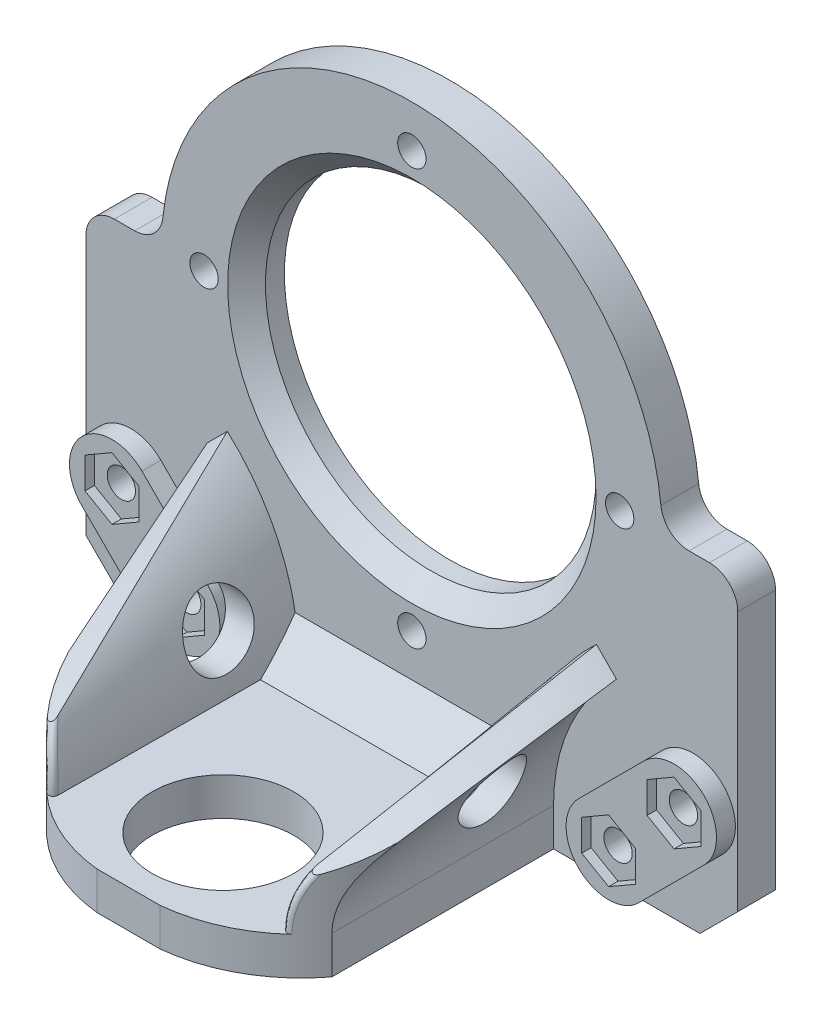
from build123d import *

# Parameters (mm, degrees)
SKETCH_1_R               = 34.5
EXTRUDE_1_DEPTH          = 4
SKETCH_2_R               = 1.5
CUT_EXTRUDE_1_DEPTH      = 4
SKETCH_3_R               = 1.5
CUT_EXTRUDE_2_DEPTH      = 4
CUT_EXTRUDE_START        = -4
CUT_EXTRUDE_3_DEPTH      = 4
FILLET_1_R               = 3
SKETCH_5_R               = 17.5
CUT_EXTRUDE_4_DEPTH      = 4
EXTRUDE_START            = 2
SKETCH_6_R               = 4.5
SKETCH_6_R_2             = 1.5
EXTRUDE_2_DEPTH          = 2
CUT_EXTRUDE_5_DEPTH      = 1
CHAMFER_1_SIZE           = 4
SKETCH_8_W               = 30
SKETCH_8_H               = 4
EXTRUDE_3_DEPTH          = 30
CUT_EXTRUDE_7_DEPTH      = 30
FILLET_3_R               = 0.5
SKETCH_13_R              = 7.5
CUT_EXTRUDE_8_DEPTH      = 30
CHAMFER_2_SIZE           = 4
CUT_EXTRUDE_9_DEPTH      = 60.468479219
CUT_EXTRUDE_9_DEPTH_BACK = 60.468479219
SKETCH_14_R              = 3.5
CHAMFER_3_SIZE           = 2


with BuildPart() as part:
    # Эскиз1 → Бобышка-Вытянуть1 (new body)
    with BuildSketch(Plane.XY):
        with BuildLine():
            Line((-34.5, 0), (-34.5, -34.5))
            Line((-34.5, -34.5), (-2e-09, -34.5))
            ThreePointArc((-2e-09, -34.5), (-24.395183952, -24.39518395), (-34.5, 0))
        make_face()
        with BuildLine():
            ThreePointArc((34.5, 0), (24.39518395, -24.395183952), (-2e-09, -34.5))
            Line((-2e-09, -34.5), (34.5, -34.5))
            Line((34.5, -34.5), (34.5, 0))
        make_face()
        Circle(SKETCH_1_R)
    extrude(amount=EXTRUDE_1_DEPTH)

    # Эскиз2 → Вырез-Вытянуть1 (cut)
    with BuildSketch(Plane.XY.offset(4)):
        with Locations((-29.750750261, -22.828553588)):
            Circle(SKETCH_2_R)
        with Locations(Location((-22.828553588, -29.750750261, 0), (0, 0, 180))):
            Circle(SKETCH_2_R)
        with Locations(Location((29.750750261, -22.828553588, 0), (0, 0, 180))):
            Circle(SKETCH_2_R)
        with Locations((22.828553588, -29.750750261)):
            Circle(SKETCH_2_R)
    extrude(amount=-CUT_EXTRUDE_1_DEPTH, mode=Mode.SUBTRACT)

    # Эскиз3 → Вырез-Вытянуть2 (cut)
    with BuildSketch(Plane.XY.offset(4)):
        with Locations((0, 22)):
            Circle(SKETCH_3_R)
        with Locations((22, 0)):
            Circle(SKETCH_3_R)
        with Locations((0, -22)):
            Circle(SKETCH_3_R)
        with Locations((-22, 0)):
            Circle(SKETCH_3_R)
    extrude(amount=-CUT_EXTRUDE_2_DEPTH, mode=Mode.SUBTRACT)

    # Эскиз4 → Вырез-Вытянуть3 (cut)
    with BuildSketch(Plane.XY.offset(4).offset(CUT_EXTRUDE_START)):
        with BuildLine():
            Line((-34.5, 0), (-26.5, 0))
            ThreePointArc((-26.5, 0), (0, 26.5), (26.5, 0))
            Line((26.5, 0), (34.5, 0))
            ThreePointArc((34.5, 0), (0, 34.5), (-34.5, 0))
        make_face()
    extrude(amount=CUT_EXTRUDE_3_DEPTH, mode=Mode.SUBTRACT)

    # Скругление1
    fillet_1_edges = [part.edges().sort_by_distance(p)[0] for p in [
        (26.5, 0, 2),
        (-26.5, 0, 2),
        (-34.5, 0, 2),
        (34.5, 0, 2),
    ]]
    fillet(fillet_1_edges, radius=FILLET_1_R)

    # Эскиз5 → Вырез-Вытянуть4 (cut)
    with BuildSketch(Plane.XY.offset(4)):
        Circle(SKETCH_5_R)
    extrude(amount=-CUT_EXTRUDE_4_DEPTH, mode=Mode.SUBTRACT)

    # Эскиз6 → Бобышка-Вытянуть2 (add)
    # profile 1 of 6: a face of its own
    with BuildSketch(Plane.XY.offset(4).offset(EXTRUDE_START)):
        with BuildLine():
            ThreePointArc((-25.250750261, -22.828553588), (-28.028674815, -26.986011484), (-32.932730776, -26.010534103))
            Line((-32.932730776, -26.010534103), (-26.010534103, -32.932730776))
            ThreePointArc((-26.010534103, -32.932730776), (-26.010534103, -26.568769746), (-19.646573072, -26.568769746))
            Line((-19.646573072, -26.568769746), (-26.568769746, -19.646573072))
            ThreePointArc((-26.568769746, -19.646573072), (-25.593292365, -21.106478142), (-25.250750261, -22.828553588))
        make_face()
    # profile 2 of 6: a face of its own
    with BuildSketch(Plane.XY.offset(4).offset(EXTRUDE_START)):
        with Locations((-29.750750261, -22.828553588)):
            Circle(SKETCH_6_R)
        with Locations((-29.750750261, -22.828553588)):
            Circle(SKETCH_6_R_2, mode=Mode.SUBTRACT)
    # profile 3 of 6: a face of its own
    with BuildSketch(Plane.XY.offset(4).offset(EXTRUDE_START)):
        with Locations((-22.828553588, -29.750750261)):
            Circle(SKETCH_6_R)
        with Locations((-22.828553588, -29.750750261)):
            Circle(SKETCH_6_R_2, mode=Mode.SUBTRACT)
    # profile 4 of 6: a face of its own
    with BuildSketch(Plane.XY.offset(4).offset(EXTRUDE_START)):
        with Locations((22.828553588, -29.750750261)):
            Circle(SKETCH_6_R)
        with Locations((22.828553588, -29.750750261)):
            Circle(SKETCH_6_R_2, mode=Mode.SUBTRACT)
    # profile 5 of 6: a face of its own
    with BuildSketch(Plane.XY.offset(4).offset(EXTRUDE_START)):
        with BuildLine():
            ThreePointArc((32.932730776, -26.010534103), (26.568769746, -26.010534103), (26.568769746, -19.646573072))
            Line((26.568769746, -19.646573072), (19.646573072, -26.568769746))
            ThreePointArc((19.646573072, -26.568769746), (24.550629033, -25.593292365), (27.328553588, -29.750750261))
            ThreePointArc((27.328553588, -29.750750261), (26.986011484, -31.472825707), (26.010534103, -32.932730776))
            Line((26.010534103, -32.932730776), (32.932730776, -26.010534103))
        make_face()
    # profile 6 of 6: a face of its own
    with BuildSketch(Plane.XY.offset(4).offset(EXTRUDE_START)):
        with Locations((29.750750261, -22.828553588)):
            Circle(SKETCH_6_R)
        with Locations((29.750750261, -22.828553588)):
            Circle(SKETCH_6_R_2, mode=Mode.SUBTRACT)
    extrude(amount=-EXTRUDE_2_DEPTH)

    # Эскиз7 → Вырез-Вытянуть5 (cut)
    with BuildSketch(Plane.XY.offset(6)):
        Polygon((-29.750750261, -26.119450122), (-26.900750261, -24.474001855), (-26.900750261, -21.183105321), (-29.750750261, -19.537657053), (-32.600750261, -21.183105321), (-32.600750261, -24.474001855), align=None)
        Polygon((-22.828553588, -26.459853727), (-25.678553588, -28.105301994), (-25.678553588, -31.396198528), (-22.828553588, -33.041646795), (-19.978553588, -31.396198528), (-19.978553588, -28.105301994), align=None)
        Polygon((19.978553588, -28.105301994), (22.828553588, -26.459853727), (25.678553588, -28.105301994), (25.678553588, -31.396198528), (22.828553588, -33.041646795), (19.978553588, -31.396198528), align=None)
        Polygon((32.600750261, -24.474001855), (29.750750261, -26.119450122), (26.900750261, -24.474001855), (26.900750261, -21.183105321), (29.750750261, -19.537657053), (32.600750261, -21.183105321), align=None)
    extrude(amount=-CUT_EXTRUDE_5_DEPTH, mode=Mode.SUBTRACT)

    # Фаска1
    chamfer_1_edges = [part.edges().sort_by_distance(p)[0] for p in [
        (-34.5, -34.5, 2),
        (34.5, -34.5, 2),
    ]]
    chamfer(chamfer_1_edges, length=CHAMFER_1_SIZE)

    # Эскиз8 → Бобышка-Вытянуть3 (add)
    with BuildSketch(Plane.XY.offset(4)):
        with Locations((0, -32.5)):
            Rectangle(SKETCH_8_W, SKETCH_8_H)
    extrude(amount=EXTRUDE_3_DEPTH)

    # По сечениям1: read off the stored shape, not the designer's step
    # По сечениям1: loft between two sections, ruled curve by curve
    loft_1_from = [
        Edge.make_bspline([(-15, -30.5, 34), (-15, -30.264816241, 34), (-15, -30.029632483, 34), (-15, -29.559264966, 34), (-15, -29.324081207, 34), (-15, -28.85371369, 34), (-15, -28.618529932, 34), (-15, -28.148162415, 34), (-15, -27.912978656, 34), (-15, -27.677794898, 34)], [0, 0, 0, 0, 0.25, 0.25, 0.5, 0.5, 0.75, 0.75, 1, 1, 1, 1], 3),
        Edge.make_bspline([(-15, -27.677794898, 34), (-14.529632483, -27.677794898, 34), (-14.059264966, -27.677794898, 34), (-13.118529932, -27.677794898, 34), (-12.648162415, -27.677794898, 34), (-12.177794898, -27.677794898, 34)], [0, 0, 0, 0, 0.5, 0.5, 1, 1, 1, 1], 3),
        Edge.make_bspline([(-12.177794898, -27.677794898, 34), (-12.177794898, -27.912978656, 34), (-12.177794898, -28.148162415, 34), (-12.177794898, -28.618529932, 34), (-12.177794898, -28.85371369, 34), (-12.177794898, -29.324081207, 34), (-12.177794898, -29.559264966, 34), (-12.177794898, -30.029632483, 34), (-12.177794898, -30.264816241, 34), (-12.177794898, -30.5, 34)], [0, 0, 0, 0, 0.25, 0.25, 0.5, 0.5, 0.75, 0.75, 1, 1, 1, 1], 3),
        Edge.make_line((-12.177794898, -30.5, 34), (-15, -30.5, 34)),
    ]
    loft_1_to = [
        Edge.make_bspline([(-15, -30.5, 4), (-15, -29.140040853, 4), (-15.140166052, -27.749844293, 4), (-15.720176691, -24.998657071, 4), (-16.160167941, -23.638346266, 4), (-17.320335881, -21.042143972, 4), (-18.040219246, -19.806908882, 4), (-19.702865433, -17.539520267, 4), (-20.64502394, -16.507711009, 4), (-21.658159972, -15.60049314, 4)], [0, 0, 0, 0, 0.25, 0.25, 0.5, 0.5, 0.75, 0.75, 1, 1, 1, 1], 3),
        Edge.make_bspline([(-21.658159972, -15.60049314, 4), (-21.304606581, -15.24693975, 4), (-20.951053191, -14.893386359, 4), (-20.24394641, -14.186279578, 4), (-19.890393019, -13.832726187, 4), (-19.536839628, -13.479172797, 4)], [0, 0, 0, 0, 0.5, 0.5, 1, 1, 1, 1], 3),
        Edge.make_bspline([(-19.536839628, -13.479172797, 4), (-18.388769508, -14.522176886, 4), (-17.322226589, -15.705329594, 4), (-15.441075488, -18.300228807, 4), (-14.627129289, -19.711590226, 4), (-13.3155443, -22.675165979, 4), (-12.818225724, -24.226656779, 4), (-12.162513282, -27.363896424, 4), (-12.003959311, -28.94889635, 4), (-12.003959311, -30.5, 4)], [0, 0, 0, 0, 0.25, 0.25, 0.5, 0.5, 0.75, 0.75, 1, 1, 1, 1], 3),
        Edge.make_line((-12.003959311, -30.5, 4), (-15, -30.5, 4)),
    ]
    loft_1 = Solid(Shell([*[Face.make_surface_from_curves(loft_1_from[k], loft_1_to[k]) for k in range(4)], Face(Wire(loft_1_from)), Face(Wire(loft_1_to))]))
    add(loft_1)

    # Зеркальное отражение1: По сечениям1 across plane
    add(loft_1.mirror(Plane(origin=(0, 0, 0), x_dir=(0, 0, 1), z_dir=(1, 0, 0))))

    # Эскиз12 → Вырез-Вытянуть7 (cut)
    with BuildSketch(Plane.XZ.offset(34.5)):
        with BuildLine():
            Line((18.329079986, 19), (25.308716528, 19))
            Line((25.308716528, 19), (25.308716528, 36.850553424))
            Line((25.308716528, 36.850553424), (-25.078405501, 36.850553424))
            Line((-25.078405501, 36.850553424), (-25.078405501, 19))
            Line((-25.078405501, 19), (-18.329079986, 19))
            ThreePointArc((-18.329079986, 19), (-17.250179605, 23.462903361), (-15, 27.465180735))
            Line((-15, 27.465180735), (-15, 34))
            Line((-15, 34), (-3.324539485, 34))
            ThreePointArc((-3.324539485, 34), (-1.662269743, 34.0826859), (0, 34))
            ThreePointArc((0, 34), (1.664539993, 34.082925086), (3.329079986, 34))
            Line((3.329079986, 34), (15, 34))
            Line((15, 34), (15, 27.466752766))
            ThreePointArc((15, 27.466752766), (17.250478386, 23.463764093), (18.329079986, 19))
        make_face()
        with BuildLine():
            ThreePointArc((3.329079986, 34), (9.845055249, 31.949041249), (15, 27.466752766))
            Line((15, 27.466752766), (15, 34))
            Line((15, 34), (3.329079986, 34))
        make_face()
        with BuildLine():
            Line((-15, 34), (-15, 27.465180735))
            ThreePointArc((-15, 27.465180735), (-9.8430989, 31.948996457), (-3.324539485, 34))
            Line((-3.324539485, 34), (-15, 34))
        make_face()
    extrude(amount=-CUT_EXTRUDE_7_DEPTH, mode=Mode.SUBTRACT)

    # Скругление3
    fillet_3_edges = [part.edges().sort_by_distance(p)[0] for p in [
        (-12.453362437, -27.871905138, 30.143416503),
        (12.453230968, -27.872436506, 30.14489925),
    ]]
    fillet(fillet_3_edges, radius=FILLET_3_R)

    # Эскиз13 → Вырез-Вытянуть8 (cut)
    with BuildSketch(Plane(origin=(0, -30.5, 0), x_dir=(1, 0, 0), z_dir=(0, 1, 0))):
        with Locations(Location((0, -24, 0), (0, 0, 270))):
            Circle(SKETCH_13_R)
    extrude(amount=-CUT_EXTRUDE_8_DEPTH, mode=Mode.SUBTRACT)

    # Фаска2
    chamfer_2_edges = [part.edges().sort_by_distance(p)[0] for p in [
        (0, -30.5, 4),
    ]]
    chamfer(chamfer_2_edges, length=CHAMFER_2_SIZE)

    # Эскиз14 → Вырез-Вытянуть9 (cut, two sides: drawn at the far end of the back side and taken through both)
    with BuildSketch(Plane(origin=(0, 0, 0), x_dir=(0, 0, -1), z_dir=(1, 0, 0)).offset(-CUT_EXTRUDE_9_DEPTH_BACK)):
        with Locations((-11.487321692, -24.830061248)):
            Circle(SKETCH_14_R)
    extrude(amount=CUT_EXTRUDE_9_DEPTH + CUT_EXTRUDE_9_DEPTH_BACK, mode=Mode.SUBTRACT)

    # Фаска3
    chamfer_3_edges = [part.edges().sort_by_distance(p)[0] for p in [
        (-17.5, 0, 4),
    ]]
    chamfer(chamfer_3_edges, length=CHAMFER_3_SIZE)


solid = part.part
